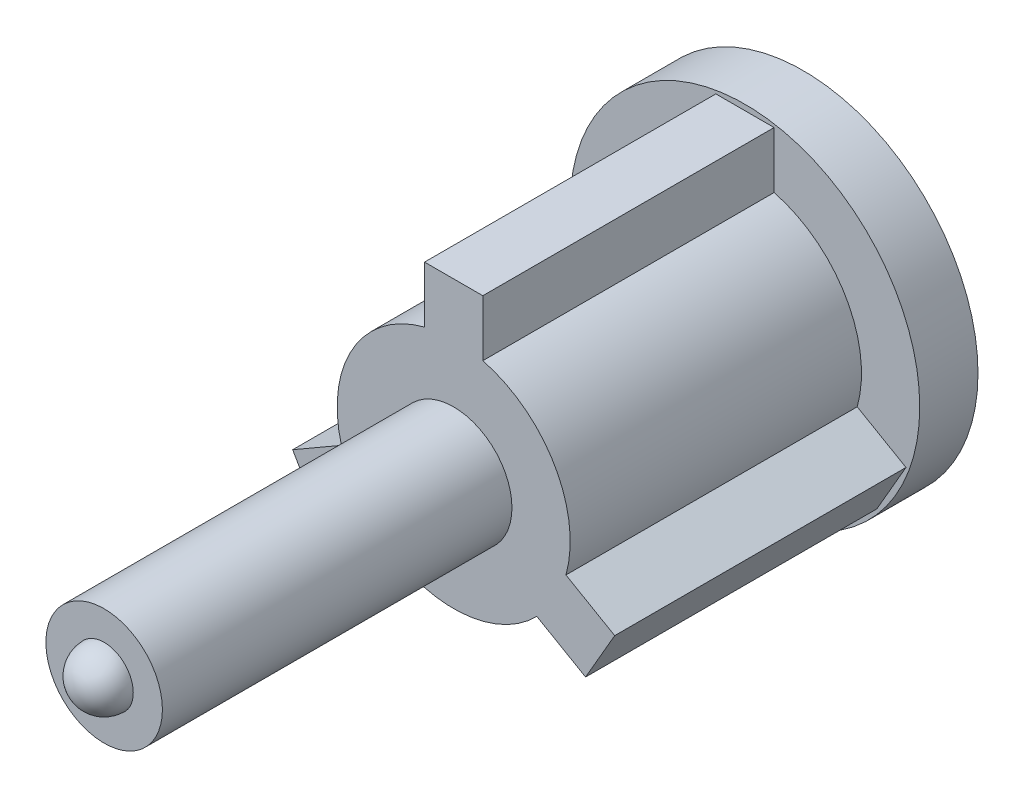
from build123d import *

# Parameters (mm, degrees)
SKETCH1_R           = 3
BOSS_EXTRUDE1_DEPTH = 1
SKETCH2_R           = 2
BOSS_EXTRUDE2_DEPTH = 5
SKETCH3_R           = 1
BOSS_EXTRUDE3_DEPTH = 6
SKETCH4_R           = 0.5
BOSS_EXTRUDE4_DEPTH = 0.5
FILLET2_R           = 0.5
SKETCH5_W           = 1
SKETCH5_H           = 1.914506357
BOSS_EXTRUDE5_DEPTH = 5
CIRPATTERN1_COUNT   = 3
SKETCH6_R           = 1.5
CUT_EXTRUDE1_DEPTH  = 5


with BuildPart() as part:
    # Sketch1 → Boss-Extrude1 (new body)
    with BuildSketch(Plane.XY):
        Circle(SKETCH1_R)
    extrude(amount=BOSS_EXTRUDE1_DEPTH)

    # Sketch2 → Boss-Extrude2 (add)
    with BuildSketch(Plane.XY.offset(1)):
        Circle(SKETCH2_R)
    extrude(amount=BOSS_EXTRUDE2_DEPTH)

    # Sketch3 → Boss-Extrude3 (add)
    with BuildSketch(Plane.XY.offset(6)):
        Circle(SKETCH3_R)
    extrude(amount=BOSS_EXTRUDE3_DEPTH)

    # Sketch4 → Boss-Extrude4 (add)
    with BuildSketch(Plane.XY.offset(12)):
        Circle(SKETCH4_R)
    extrude(amount=BOSS_EXTRUDE4_DEPTH)

    # Fillet2
    fillet2_edges = [part.edges().sort_by_distance(p)[0] for p in [
        (-0.5, 0, 12.5),
    ]]
    fillet(fillet2_edges, radius=FILLET2_R - 0.0001)  # a hair under: the kernel refuses the full size

    # Sketch5 → Boss-Extrude5 (add)
    with BuildSketch(Plane.XY.offset(1)):
        with Locations((0, 1.945455643)):
            Rectangle(SKETCH5_W, SKETCH5_H)
    boss_extrude5 = extrude(amount=BOSS_EXTRUDE5_DEPTH)

    # CirPattern1: Boss-Extrude5 ×3 about axis
    cirpattern1_axis = Axis((0, 0, 0), (0, 0, 1))
    for i in range(1, CIRPATTERN1_COUNT):
        add(boss_extrude5.rotate(cirpattern1_axis, i * 360 / CIRPATTERN1_COUNT))

    # Sketch6 → Cut-Extrude1 (cut)
    with BuildSketch(Plane(origin=(0, 0, 0), x_dir=(-1, 0, 0), z_dir=(0, 0, -1))):
        Circle(SKETCH6_R)
    extrude(amount=-CUT_EXTRUDE1_DEPTH, mode=Mode.SUBTRACT)


solid = part.part
